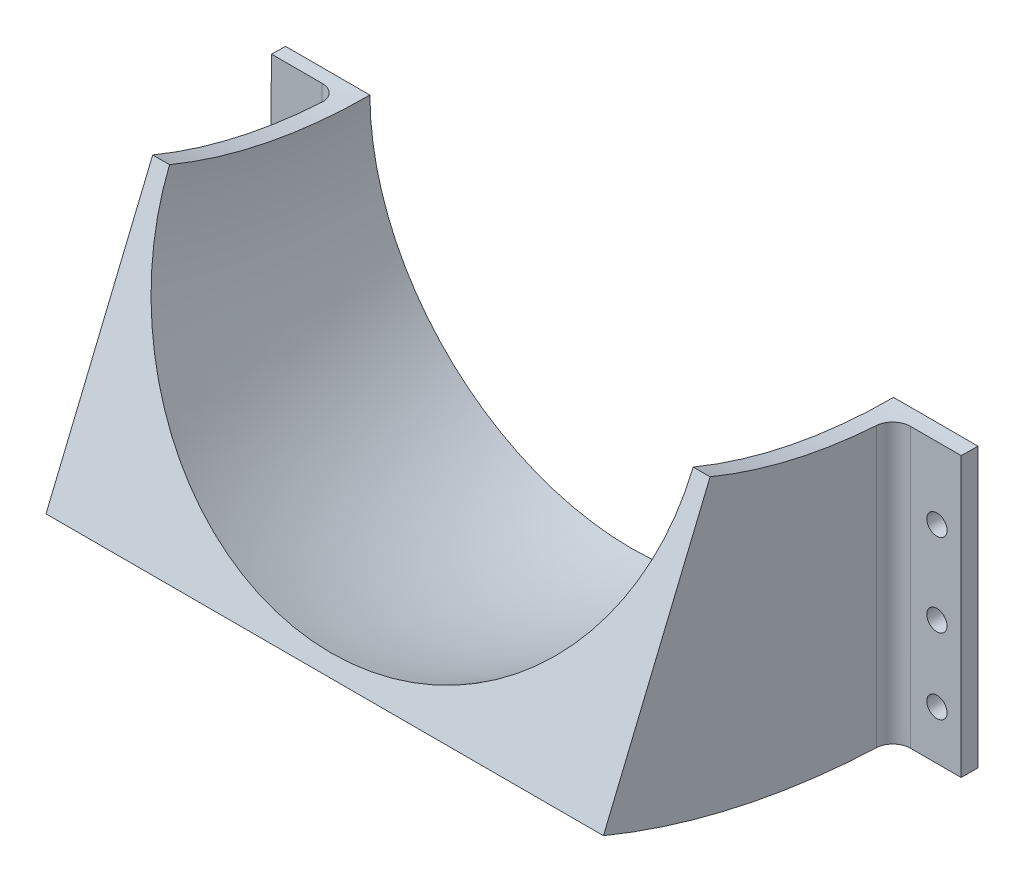
from build123d import *

# Parameters (mm, degrees)
REVOLVE8_ANGLE         = 22.5
BOSS_EXTRUDE3_START    = 12.7
BOSS_EXTRUDE3_DEPTH    = 12.7
BOSS_EXTRUDE4_DEPTH    = 12.7
SKETCH12_R             = 1.905
CUT_EXTRUDE4_DEPTH     = 3.175
SKETCH13_R             = 1.905
CUT_EXTRUDE5_DEPTH     = 3.175
FLANGE_REINFORCEMENT_R = 3.175


with BuildPart() as part:
    # Sketch9 → Revolve8 (revolve)
    with BuildSketch(Plane.XY):
        with BuildLine():
            Line((-49.2252, -98.425), (-52.4002, -98.425))
            Line((-52.4002, -98.425), (-52.4002, -150.8252))
            Line((-52.4002, -150.8252), (52.4002, -150.8252))
            Line((52.4002, -150.8252), (52.4002, -98.425))
            Line((52.4002, -98.425), (49.2252, -98.425))
            ThreePointArc((49.2252, -98.425), (0, -147.6502), (-49.2252, -98.425))
        make_face()
    revolve(axis=Axis((-38.048924234, 0, 0), (-1, 0, 0)), revolution_arc=REVOLVE8_ANGLE)

    # Sketch11 → Boss-Extrude3 (add)
    with BuildSketch(Plane.ZY.offset(52.4002).offset(BOSS_EXTRUDE3_START)):
        with BuildLine():
            Line((0, -98.425), (0, -150.8252))
            ThreePointArc((0, -150.8252), (1.5875, -150.816845209), (3.174824124, -150.791781762))
            Line((3.174824124, -150.791781762), (2.623242695, -98.390036197))
            ThreePointArc((2.623242695, -98.390036197), (1.311737846, -98.416258661), (0, -98.425))
        make_face()
    extrude(amount=-BOSS_EXTRUDE3_DEPTH)

    # Sketch10 → Boss-Extrude4 (add)
    with BuildSketch(Plane(origin=(52.4002, 0, 0), x_dir=(0, 0, -1), z_dir=(1, 0, 0))):
        with BuildLine():
            Line((0, -98.425), (0, -150.8252))
            Line((0, -150.8252), (-3.174824124, -150.791781762))
            Line((-3.174824124, -150.791781762), (-3.174824124, -98.37378267))
            ThreePointArc((-3.174824124, -98.37378267), (-1.587618613, -98.412194834), (0, -98.425))
        make_face()
    extrude(amount=BOSS_EXTRUDE4_DEPTH)

    # Sketch12 → Cut-Extrude4 (cut)
    with BuildSketch(Plane.XY.offset(3.174824124)):
        with Locations((60.550186424, -111.886000657)):
            Circle(SKETCH12_R)
        with Locations((60.550186424, -141.566764633)):
            Circle(SKETCH12_R)
        with Locations((60.550186424, -127.4445)):
            Circle(SKETCH12_R)
    extrude(amount=-CUT_EXTRUDE4_DEPTH, mode=Mode.SUBTRACT)

    # Sketch13 → Cut-Extrude5 (cut)
    with BuildSketch(Plane(origin=(0, -0.008353865, 1.587675876), x_dir=(1, 0, 0), z_dir=(-8.55203915581382e-15, 0.010525429437517081, 0.9999446061333377))):
        with Locations(Location((-60.754019077, -141.521938379, 0), (0, 0, 270))):
            Circle(SKETCH13_R)
        with Locations(Location((-60.754019077, -112.479497113, 0), (0, 0, 270))):
            Circle(SKETCH13_R)
        with Locations(Location((-60.754019077, -127.4445, 0), (0, 0, 270))):
            Circle(SKETCH13_R)
    extrude(amount=-CUT_EXTRUDE5_DEPTH, mode=Mode.SUBTRACT)

    # Flange Reinforcement
    # the kernel refuses this fillet: 3.175 mm, written as the material it adds along each edge
    with BuildSketch(Plane(origin=(-52.4002, -158.728842073, 3.258369721), x_dir=(-8.951719505639043e-15, 0.010525429437517086, 0.9999446061333377), z_dir=(-8.181600859283099e-15, 0.9999446061333378, -0.01052542943751709))) as flange_reinforcement_piece_1_section:
        with BuildLine():
            CenterArc((FLANGE_REINFORCEMENT_R, -FLANGE_REINFORCEMENT_R), FLANGE_REINFORCEMENT_R, 90, 90)
            Line((0, -FLANGE_REINFORCEMENT_R), (0, 0))
            Line((0, 0), (FLANGE_REINFORCEMENT_R, 0))
        make_face()
    flange_reinforcement_piece_1 = extrude(amount=68.279648461, mode=Mode.PRIVATE)
    flange_reinforcement_piece_1 = flange_reinforcement_piece_1 - Plane(origin=(-53.118961538, 0, 0), x_dir=(0, -1, 0), z_dir=(-1, 0, 0)) * Cylinder(98.425, 150, mode=Mode.PRIVATE)
    flange_reinforcement_piece_1 = flange_reinforcement_piece_1 & Plane(origin=(-53.118961538, 0, 0), x_dir=(0, -1, 0), z_dir=(1, 0, 0)) * Cylinder(150.8252, 150, mode=Mode.PRIVATE)
    add(flange_reinforcement_piece_1)
    with BuildSketch(Plane(origin=(52.4002, -158.729281762, 3.174824124), x_dir=(0, 0, 1), z_dir=(0, 1, 0))) as flange_reinforcement_piece_2_section:
        with BuildLine():
            CenterArc((FLANGE_REINFORCEMENT_R, FLANGE_REINFORCEMENT_R), FLANGE_REINFORCEMENT_R, 180, 90)
            Line((0, FLANGE_REINFORCEMENT_R), (0, 0))
            Line((0, 0), (FLANGE_REINFORCEMENT_R, 0))
        make_face()
    flange_reinforcement_piece_2 = extrude(amount=68.292999092, mode=Mode.PRIVATE)
    flange_reinforcement_piece_2 = flange_reinforcement_piece_2 - Plane(origin=(53.118931151, 0, 0), x_dir=(0, -1, 0), z_dir=(-1, 0, 0)) * Cylinder(98.425, 150, mode=Mode.PRIVATE)
    flange_reinforcement_piece_2 = flange_reinforcement_piece_2 & Plane(origin=(53.118931151, 0, 0), x_dir=(0, -1, 0), z_dir=(1, 0, 0)) * Cylinder(150.8252, 150, mode=Mode.PRIVATE)
    add(flange_reinforcement_piece_2)


solid = part.part
